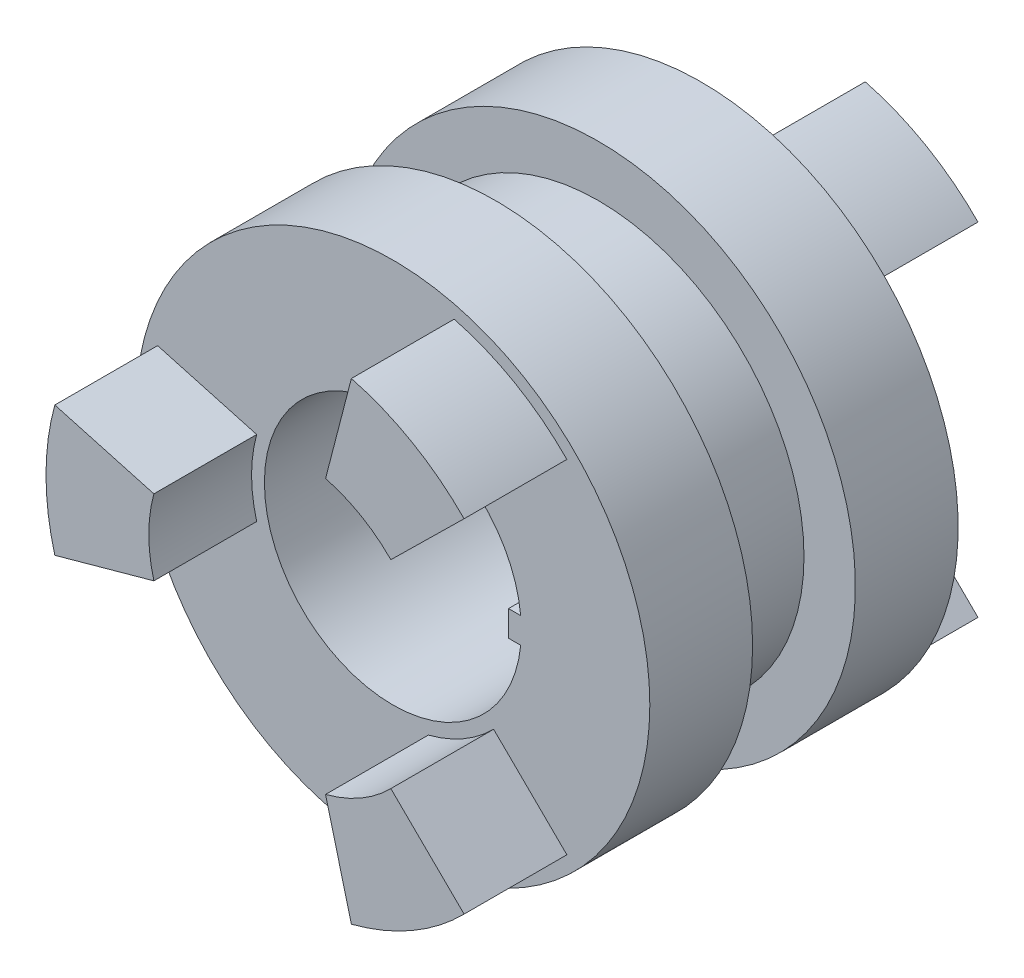
from build123d import *

# Parameters (mm, degrees)
SKETCH1_R           = 10.000000000000004
SKETCH1_R_2         = 5.000000000000002
BOSS_EXTRUDE2_DEPTH = 4
BOSS_EXTRUDE3_DEPTH = 4
SKETCH3_W           = 1
SKETCH3_H           = 1
BOSS_EXTRUDE4_DEPTH = 4
BOSS_EXTRUDE5_START = 4
SKETCH4_R           = 8
BOSS_EXTRUDE5_DEPTH = 4
BOSS_EXTRUDE6_START = 4
SKETCH5_R           = 10.000000000000005
BOSS_EXTRUDE6_DEPTH = 4
BOSS_EXTRUDE7_START = 4
BOSS_EXTRUDE7_DEPTH = 4


with BuildPart() as part:
    # Sketch1 → Boss-Extrude2 (new body)
    with BuildSketch(Plane.XY):
        Circle(SKETCH1_R)
        Circle(SKETCH1_R_2, mode=Mode.SUBTRACT)
    extrude(amount=BOSS_EXTRUDE2_DEPTH)

    # Sketch2 → Boss-Extrude3 (add)
    with BuildSketch(Plane.XY.offset(4)):
        with BuildLine():
            ThreePointArc((-5.300838508093688, -1.4666666666666648), (-5.500000000000001, 1.33e-15), (-5.300838508093688, 1.4666666666666672))
            Line((-5.300838508093687, 1.4666666666666668), (-9.155993786707278, 2.533333333333333))
            ThreePointArc((-9.155993786707278, 2.533333333333333), (-9.500000000000004, 2.22e-15), (-9.155993786707278, -2.533333333333329))
            Line((-9.155993786707278, -2.5333333333333297), (-5.300838508093687, -1.4666666666666646))
        make_face()
        with BuildLine():
            Line((2.384065870432892, 9.1959898828483), (1.380248661829498, 5.323994142701923))
            ThreePointArc((1.3802486618293501, 5.323994142701352), (2.7499999999996056, 4.763139720814642), (3.92058984626361, 3.8573274760350205))
            Line((3.92058984626385, 3.8573274760352567), (6.771927916274045, 6.66265654951497))
            ThreePointArc((6.771927916273804, 6.6626565495147325), (4.749999999999606, 8.227241335952398), (2.3840658704327446, 9.19598988284773))
        make_face()
        with BuildLine():
            ThreePointArc((3.92058984626449, -3.857327476034126), (2.7500000000005467, -4.763139720814099), (1.3802486618302343, -5.323994142701123))
            Line((1.380248661830149, -5.323994142700796), (2.3840658704335453, -9.195989882847172))
            ThreePointArc((2.384065870433624, -9.1959898828475), (4.750000000000542, -8.227241335951856), (6.771927916274685, -6.662656549513837))
            Line((6.771927916274697, -6.662656549513839), (3.920589846264499, -3.8573274760341296))
        make_face()
    extrude(amount=BOSS_EXTRUDE3_DEPTH)

    # Sketch3 → Boss-Extrude4 (add)
    with BuildSketch(Plane(origin=(0, 0, 0), x_dir=(-1, 0, 0), z_dir=(0, 0, -1))):
        with Locations((-5.000000000000003, 5.3e-16)):
            Rectangle(SKETCH3_W, SKETCH3_H)
    extrude(amount=-BOSS_EXTRUDE4_DEPTH)

    # Sketch4 → Boss-Extrude5 (add)
    with BuildSketch(Plane(origin=(0, 0, 0), x_dir=(-1, 0, 0), z_dir=(0, 0, -1)).offset(BOSS_EXTRUDE5_START)):
        Circle(SKETCH4_R)
        with BuildLine():
            Line((-4.974937185533101, 0.49999999999999944), (-4.500000000000003, 0.49999999999999944))
            Line((-4.500000000000003, 0.49999999999999944), (-4.500000000000003, -0.49999999999999944))
            Line((-4.500000000000003, -0.49999999999999944), (-4.974937185533101, -0.49999999999999944))
            ThreePointArc((-4.974937185533101, -0.49999999999999944), (5.000000000000001, 0), (-4.974937185533101, 0.49999999999999944))
        make_face(mode=Mode.SUBTRACT)
    extrude(amount=-BOSS_EXTRUDE5_DEPTH)

    # Sketch5 → Boss-Extrude6 (add)
    with BuildSketch(Plane(origin=(0, 0, -4), x_dir=(-1, 0, 0), z_dir=(0, 0, -1)).offset(BOSS_EXTRUDE6_START)):
        Circle(SKETCH5_R)
        with BuildLine():
            Line((-4.974937185533101, 0.49999999999999944), (-4.500000000000003, 0.49999999999999944))
            Line((-4.500000000000003, 0.49999999999999944), (-4.500000000000003, -0.49999999999999944))
            Line((-4.500000000000003, -0.49999999999999944), (-4.974937185533101, -0.49999999999999944))
            ThreePointArc((-4.974937185533101, -0.49999999999999944), (5.000000000000001, 0), (-4.974937185533101, 0.49999999999999944))
        make_face(mode=Mode.SUBTRACT)
    extrude(amount=-BOSS_EXTRUDE6_DEPTH)

    # Sketch6 → Boss-Extrude7 (add)
    with BuildSketch(Plane(origin=(0, 0, -8), x_dir=(-1, 0, 0), z_dir=(0, 0, -1)).offset(BOSS_EXTRUDE7_START)):
        with BuildLine():
            ThreePointArc((-3.920589846263494, 3.8573274760349054), (-2.749999999999525, 4.7631397208145), (-1.3802486618293084, 5.323994142701195))
            Line((-1.380248661829498, 5.323994142701923), (-2.384065870432886, 9.195989882848306))
            ThreePointArc((-2.3840658704327384, 9.195989882847735), (-4.749999999999603, 8.227241335952403), (-6.771927916273809, 6.662656549514737))
            Line((-6.771927916274226, 6.662656549515149), (-3.920589846263851, 3.857327476035258))
        make_face()
        with BuildLine():
            Line((9.155993786708173, 2.533333333333582), (5.30083850809434, 1.4666666666668489))
            ThreePointArc((5.30083850809353, 1.4666666666666248), (5.499999999999838, 1.7542e-13), (5.300838508093624, -1.4666666666662858))
            Line((5.30083850809434, -1.466666666666484), (9.155993786707931, -2.5333333333331565))
            ThreePointArc((9.155993786707375, -2.5333333333330024), (9.500000000000007, 1.7319e-13), (9.155993786707281, 2.5333333333333363))
        make_face()
        with BuildLine():
            ThreePointArc((-1.3802486618296232, -5.323994142701113), (-2.749999999999917, -4.763139720814274), (-3.920589846263901, -3.857327476034492))
            Line((-3.920589846264016, -3.857327476034606), (-6.771927916274218, -6.662656549514316))
            ThreePointArc((-6.771927916274223, -6.662656549514313), (-4.75, -8.227241335952176), (-2.3840658704330573, -9.195989882847654))
            Line((-2.3840658704331217, -9.195989882847895), (-1.3802486618296637, -5.323994142701272))
        make_face()
    extrude(amount=-BOSS_EXTRUDE7_DEPTH)


solid = part.part
